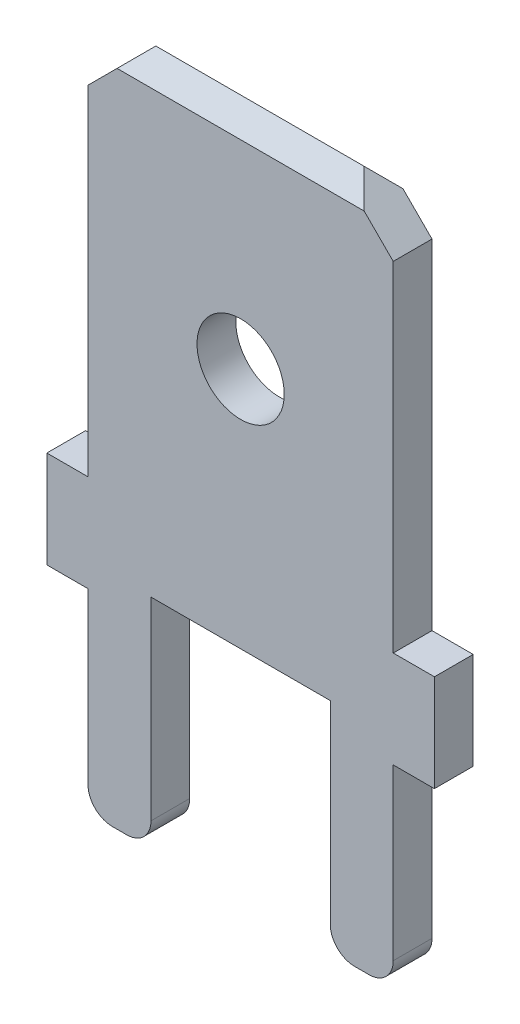
from build123d import *

# Parameters (mm, degrees)
EXTRUSION1_DEPTH   = 0.8
CHANFREIN1_SIZE    = 0.4
CONG_1_R           = 0.5
SKETCH1_R          = 0.9
CUT_EXTRUDE1_DEPTH = 16.45606677


with BuildPart() as part:
    # Esquisse1 → Extrusion1 (new body)
    with BuildSketch(Plane.XY):
        Polygon((-0.65, 0), (0.65, 0), (0.65, 4.5), (4.35, 4.5), (4.35, 0), (5.65, 0), (5.65, 4), (6.5, 4), (6.5, 6), (5.65, 6), (5.65, 13), (4.65, 14), (0.35, 14), (-0.65, 13), (-0.65, 6), (-1.5, 6), (-1.5, 4), (-0.65, 4), align=None)
    extrude(amount=EXTRUSION1_DEPTH)

    # Chanfrein1
    chanfrein1_edges = [part.edges().sort_by_distance(p)[0] for p in [
        (2.5, 14, 0.8),
        (2.5, 14, 0),
    ]]
    chamfer(chanfrein1_edges, length=CHANFREIN1_SIZE - 0.0001)  # a hair under: the kernel refuses the full size

    # Congé1
    cong_1_edges = [part.edges().sort_by_distance(p)[0] for p in [
        (5.65, 0, 0.4),
        (4.35, 0, 0.4),
        (0.65, 0, 0.4),
        (-0.65, 0, 0.4),
    ]]
    fillet(cong_1_edges, radius=CONG_1_R)

    # Sketch1 → Cut-Extrude1 (cut, through all)
    with BuildSketch(Plane.XY.offset(0.8)):
        with Locations((2.5, 9.5)):
            Circle(SKETCH1_R)
    extrude(amount=-CUT_EXTRUDE1_DEPTH, mode=Mode.SUBTRACT)


solid = part.part
